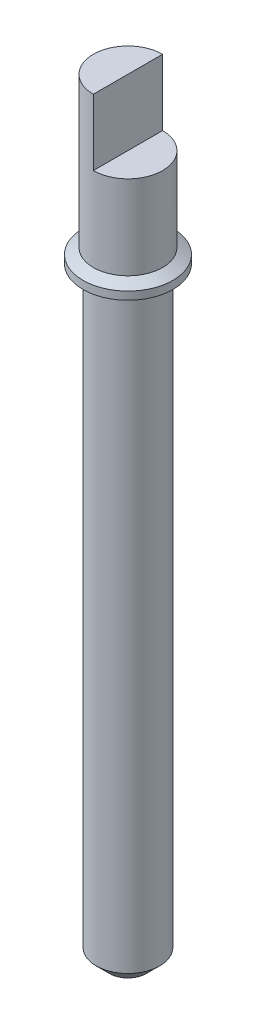
from build123d import *

# Parameters (mm, degrees)
SKETCH1_R           = 0.6
BOSS_EXTRUDE1_DEPTH = 11.45
CHAMFER1_SIZE       = 0.25
SKETCH3_R           = 0.85
BOSS_EXTRUDE2_DEPTH = 0.15
SKETCH4_R           = 0.655
BOSS_EXTRUDE3_DEPTH = 2.95
SKETCH5_W           = 0.965055555
SKETCH5_H           = 1.860066756
CUT_EXTRUDE1_DEPTH  = 1.25
CHAMFER2_SIZE       = 0.195
CHAMFER2_SIZE_2     = 0.112583302
CHAMFER3_SIZE       = 0.144
CHAMFER3_SIZE2      = 0.249415316


with BuildPart() as part:
    # Sketch1 → Boss-Extrude1 (new body)
    with BuildSketch(Plane(origin=(0, 0, 0), x_dir=(1, 0, 0), z_dir=(0, 1, 0))):
        with Locations(Location((0, 0, 0), (0, 0, 270))):
            Circle(SKETCH1_R)
    extrude(amount=BOSS_EXTRUDE1_DEPTH)

    # Chamfer1
    chamfer1_edges = [part.edges().sort_by_distance(p)[0] for p in [
        (0, 0, -0.6),
    ]]
    chamfer(chamfer1_edges, length=CHAMFER1_SIZE)

    # Sketch3 → Boss-Extrude2 (add)
    with BuildSketch(Plane(origin=(0, 11.45, 0), x_dir=(1, 0, 0), z_dir=(0, 1, 0))):
        with Locations(Location((0, 0, 0), (0, 0, 270))):
            Circle(SKETCH3_R)
    extrude(amount=BOSS_EXTRUDE2_DEPTH)

    # Sketch4 → Boss-Extrude3 (add)
    with BuildSketch(Plane(origin=(0, 11.6, 0), x_dir=(1, 0, 0), z_dir=(0, 1, 0))):
        with Locations(Location((0, 0, 0), (0, 0, 270))):
            Circle(SKETCH4_R)
    extrude(amount=BOSS_EXTRUDE3_DEPTH)

    # Sketch5 → Cut-Extrude1 (cut)
    with BuildSketch(Plane(origin=(0, 14.55, 0), x_dir=(1, 0, 0), z_dir=(0, 1, 0))):
        with Locations((0.482527778, -0.010701221)):
            Rectangle(SKETCH5_W, SKETCH5_H)
    extrude(amount=-CUT_EXTRUDE1_DEPTH, mode=Mode.SUBTRACT)

    # Chamfer2
    # the kernel refuses this chamfer: 0.195, 0.112583302 mm, written as the material it adds along each edge
    with BuildSketch(Plane(origin=(0, 11.6, 0), x_dir=(0, 0, 1), z_dir=(-1, 0, 0))) as chamfer2_piece_1_section:
        Polygon((0.655 + CHAMFER2_SIZE, 0), (0.655, CHAMFER2_SIZE_2 * 1.00000000437), (0.655, 0), align=None)
    chamfer2_piece_1 = revolve(axis=Axis((0, 11.6, 0), (0, 1, 0)), mode=Mode.PRIVATE)
    chamfer2_piece_1 = chamfer2_piece_1 & Plane(origin=(0, 11.654924412, 0), x_dir=(0, 0, 1), z_dir=(0, -1, 0)) * Cylinder(0.85, 4, mode=Mode.PRIVATE)
    add(chamfer2_piece_1)

    # Chamfer3
    chamfer3_edges = [part.edges().sort_by_distance(p)[0] for p in [
        (0, 11.45, -0.6),
    ]]
    chamfer3_side = [part.faces().sort_by_distance(p)[0] for p in [
        (0, 5.85, -0.6),
    ]]
    chamfer(chamfer3_edges, length=CHAMFER3_SIZE, length2=CHAMFER3_SIZE2, reference=chamfer3_side[0])


solid = part.part
